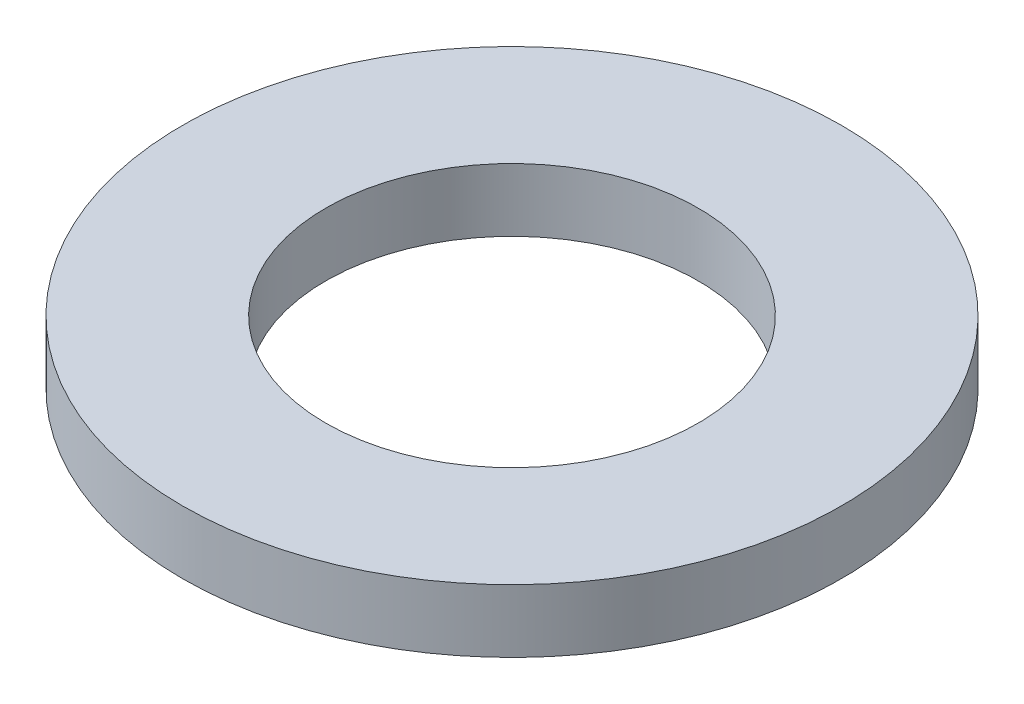
from build123d import *

# Parameters (mm, degrees)
SKETCH1_R           = 57.5
BOSS_EXTRUDE1_DEPTH = 11
SKETCH2_R           = 32.5
CUT_EXTRUDE1_DEPTH  = 83.057906383


with BuildPart() as part:
    # Sketch1 → Boss-Extrude1 (new body)
    with BuildSketch(Plane(origin=(0, 0, 0), x_dir=(1, 0, 0), z_dir=(0, 1, 0))):
        Circle(SKETCH1_R)
    extrude(amount=BOSS_EXTRUDE1_DEPTH)

    # Sketch2 → Cut-Extrude1 (cut, through all)
    with BuildSketch(Plane(origin=(0, 0, 0), x_dir=(1, 0, 0), z_dir=(0, 1, 0))):
        Circle(SKETCH2_R)
    extrude(amount=CUT_EXTRUDE1_DEPTH, mode=Mode.SUBTRACT)


solid = part.part
